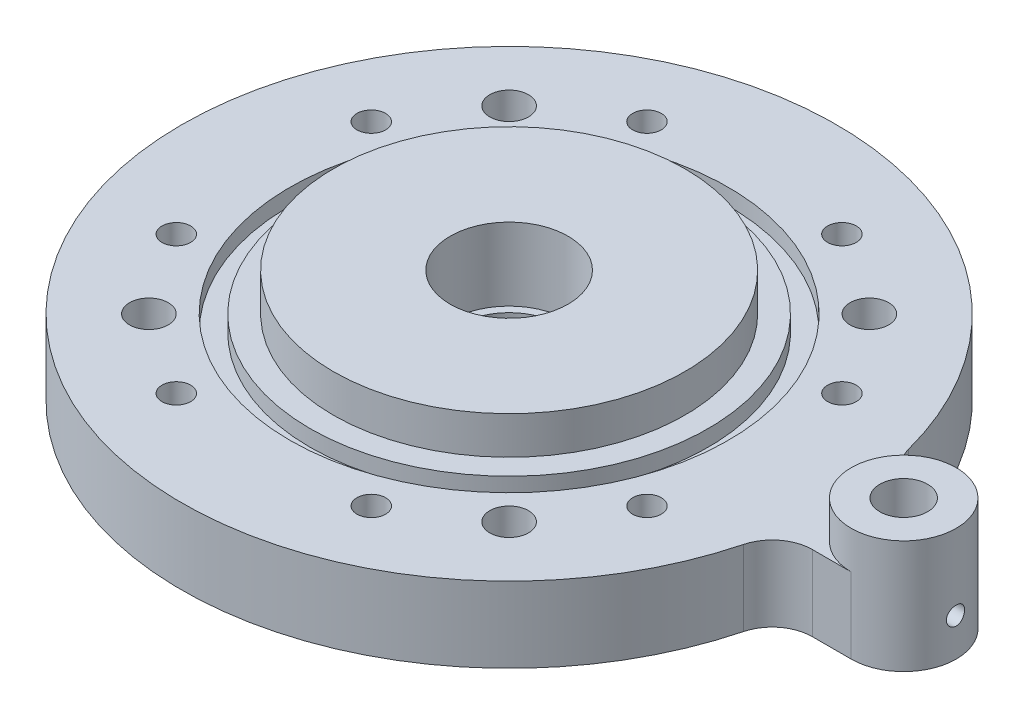
from build123d import *

# Parameters (mm, degrees)
BASE_DEPTH                       = 13.175
SKETCH3_R                        = 3.373437
SKETCH3_R_2                      = 3.373438
SQUARE_BOLT_HOLES_DEPTH          = 98.608945
SKETCH4_R                        = 2.5
HOUSING_BOLTS_DEPTH              = 44.33
CIRPATTERN1_COUNT                = 8
SKETCH2_R                        = 30.6705
SKETCH2_R_2                      = 9.167187
SKETCH2_R_3                      = 4.167187
IMPELLER_CAVITY_RISER_DEPTH      = 6.59
SKETCH5_R                        = 10.287
SEAL_BORE_DEPTH                  = 12.7
SKETCH6_R                        = 8.89
BORE_DEPTH                       = 39.3
PRESSURE_TAP_DEPTH               = 130.310741
PRESSURE_TAP_DEPTH_BACK          = 57.15
SKETCH9_R                        = 1.5875
SKETCH10_R                       = 1.5875
PRESSURE_TAP_VERTICAL_HOLE_DEPTH = 8.175
SKETCH12_R                       = 38.2524
SKETCH12_R_2                     = 34.7218
O_RING_FEATURE_DEPTH             = 2.82448


with BuildPart() as part:
    # Sketch1 → base (new body)
    with BuildSketch(Plane(origin=(0, 0, 0), x_dir=(1, 0, 0), z_dir=(0, 1, 0))):
        with BuildLine():
            Line((62.079341, 9.167187), (68.857187, 9.167187))
            ThreePointArc((68.857187, 9.167187), (78.024375, 0), (68.857187, -9.167187))
            Line((68.857187, -9.167187), (62.079341, -9.167187))
            ThreePointArc((62.079341, -9.167187), (57.798515, -10.628728), (55.30529, -14.403036))
            ThreePointArc((55.30529, -14.403036), (-57.15, 0), (55.30529, 14.403036))
            ThreePointArc((55.30529, 14.403036), (57.798515, 10.628728), (62.079341, 9.167187))
        make_face()
    extrude(amount=BASE_DEPTH)

    # Sketch3 → square bolt holes (cut, through all)
    with BuildSketch(Plane.XZ):
        with Locations((-31.430896, -31.430896)):
            Circle(SKETCH3_R)
        with Locations((-31.430896, 31.430896)):
            Circle(SKETCH3_R)
        with Locations((31.430896, 31.430896)):
            Circle(SKETCH3_R_2)
        with Locations((31.430896, -31.430896)):
            Circle(SKETCH3_R_2)
    extrude(amount=-SQUARE_BOLT_HOLES_DEPTH, mode=Mode.SUBTRACT)

    # Sketch4 → housing bolts (cut)
    with BuildSketch(Plane(origin=(0, 13.175, 0), x_dir=(1, 0, 0), z_dir=(0, 1, 0))):
        with Locations((17.010279, 41.066445)):
            Circle(SKETCH4_R)
    housing_bolts = extrude(amount=-HOUSING_BOLTS_DEPTH, mode=Mode.SUBTRACT)

    # CirPattern1: housing bolts ×8 about axis
    cirpattern1_axis = Axis((0, 13.175, 0), (0, 1, 0))
    for i in range(1, CIRPATTERN1_COUNT):
        add(housing_bolts.rotate(cirpattern1_axis, i * 360 / CIRPATTERN1_COUNT), mode=Mode.SUBTRACT)

    # Sketch2 → impeller cavity riser (add)
    # profile 1 of 2: a face of its own
    with BuildSketch(Plane(origin=(0, 13.175, 0), x_dir=(1, 0, 0), z_dir=(0, 1, 0))):
        Circle(SKETCH2_R)
    # profile 2 of 2: a face of its own
    with BuildSketch(Plane(origin=(0, 13.175, 0), x_dir=(1, 0, 0), z_dir=(0, 1, 0))):
        with Locations((68.857187, 0)):
            Circle(SKETCH2_R_2)
        with Locations((68.857187, 0)):
            Circle(SKETCH2_R_3, mode=Mode.SUBTRACT)
    extrude(amount=IMPELLER_CAVITY_RISER_DEPTH)

    # Sketch5 → seal bore (cut)
    with BuildSketch(Plane(origin=(0, 19.765, 0), x_dir=(1, 0, 0), z_dir=(0, 1, 0))):
        Circle(SKETCH5_R)
    extrude(amount=-SEAL_BORE_DEPTH, mode=Mode.SUBTRACT)

    # Sketch6 → bore (cut)
    with BuildSketch(Plane(origin=(0, 7.065, 0), x_dir=(1, 0, 0), z_dir=(0, 1, 0))):
        Circle(SKETCH6_R)
    extrude(amount=-BORE_DEPTH, mode=Mode.SUBTRACT)

    # Sketch9 → pressure tap (cut, two sides: drawn at the far end of the back side and taken through both)
    with BuildSketch(Plane(origin=(57.15, 0, 0), x_dir=(0, 0, -1), z_dir=(1, 0, 0)).offset(-PRESSURE_TAP_DEPTH_BACK)):
        with Locations((0, 6.5875)):
            Circle(SKETCH9_R)
    extrude(amount=PRESSURE_TAP_DEPTH + PRESSURE_TAP_DEPTH_BACK, mode=Mode.SUBTRACT)

    # Sketch10 → pressure tap vertical hole (cut)
    with BuildSketch(Plane(origin=(0, 13.175, 0), x_dir=(1, 0, 0), z_dir=(0, 1, 0))):
        with Locations((68.857187, 0)):
            Circle(SKETCH10_R)
    extrude(amount=-PRESSURE_TAP_VERTICAL_HOLE_DEPTH, mode=Mode.SUBTRACT)

    # Sketch12 → o ring feature (cut)
    with BuildSketch(Plane(origin=(0, 13.175, 0), x_dir=(1, 0, 0), z_dir=(0, 1, 0))):
        Circle(SKETCH12_R)
        Circle(SKETCH12_R_2, mode=Mode.SUBTRACT)
    extrude(amount=-O_RING_FEATURE_DEPTH, mode=Mode.SUBTRACT)


solid = part.part
